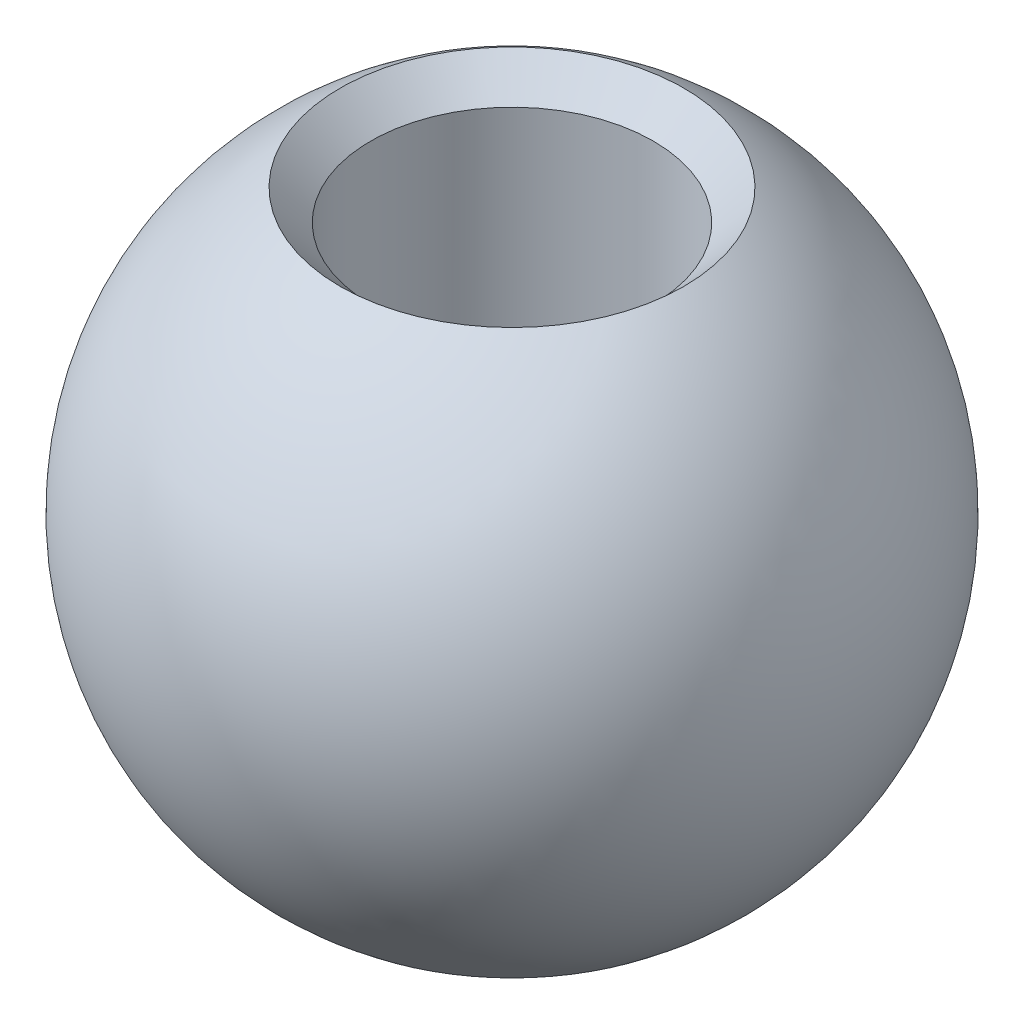
from build123d import *

# Parameters (mm, degrees)
CHAMFER1_SIZE   = 1
CHAMFER1_SIZE_2 = 0.75070604


with BuildPart() as part:
    # Sketch1 → Revolve1 (revolve)
    with BuildSketch(Plane.XY):
        with BuildLine():
            ThreePointArc((7, 0), (5.916079783, 3.741657387), (3, 6.32455532))
            Line((3, 6.32455532), (3, -6.32455532))
            ThreePointArc((3, -6.32455532), (5.916079783, -3.741657387), (7, 0))
        make_face()
    revolve(axis=Axis((0, 0, 0), (0, 1, 0)))

    # Chamfer1
    # the kernel refuses this chamfer: 1, 0.75070604 mm, written as the material it takes off along each edge
    with BuildSketch(Plane(origin=(0, 6.32455532, 0), x_dir=(1, 0, 0), z_dir=(0, 0, 1))) as chamfer1_piece_1:
        with BuildLine():
            Line((3.649074607, -0.350925393), (3, -CHAMFER1_SIZE))
            Line((3, -CHAMFER1_SIZE), (3, 0))
            ThreePointArc((3, 0), (3.334183259, -0.169620553), (3.649074607, -0.350925393))
        make_face()
    revolve(axis=Axis((0, 6.32455532, 0), (0, 1, 0)), mode=Mode.SUBTRACT)
    with BuildSketch(Plane(origin=(0, -6.32455532, 0), x_dir=(1, 0, 0), z_dir=(0, 0, 1))) as chamfer1_piece_2:
        with BuildLine():
            Line((3.819592149, 0.458490557), (3, CHAMFER1_SIZE_2))
            Line((3, CHAMFER1_SIZE_2), (3, 0))
            ThreePointArc((3, 0), (3.428975196, 0.221922355), (3.819592149, 0.458490557))
        make_face()
    revolve(axis=Axis((0, -6.32455532, 0), (0, 1, 0)), mode=Mode.SUBTRACT)


solid = part.part
